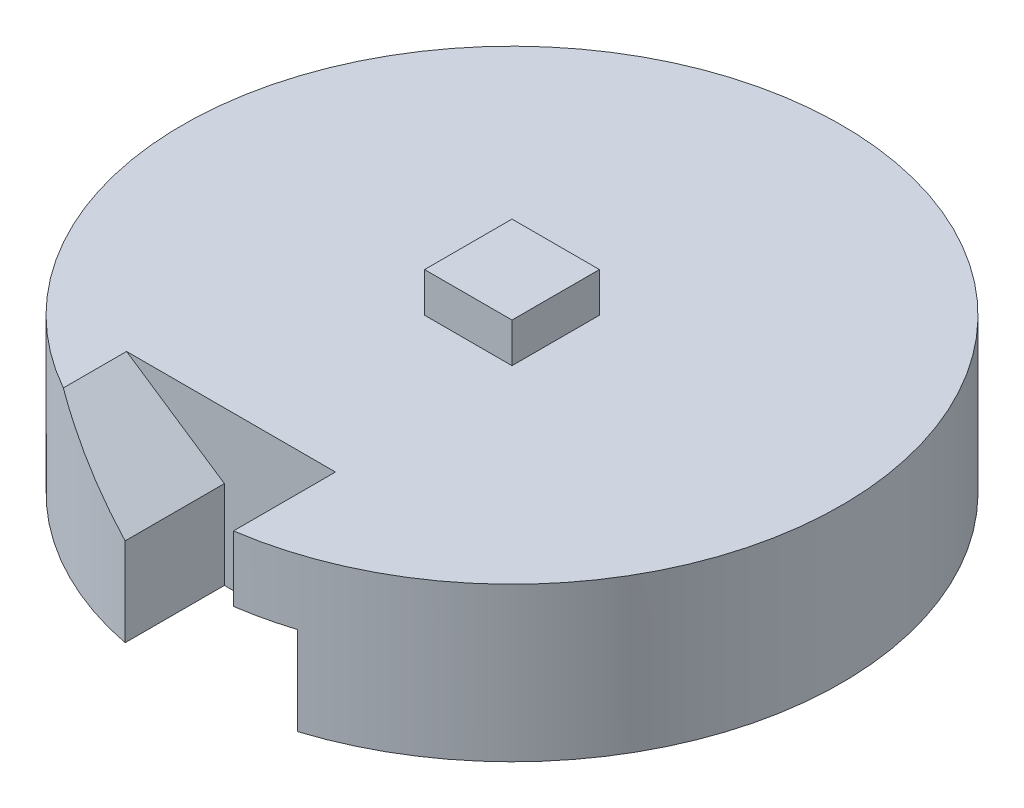
from build123d import *

# Parameters (mm, degrees)
SKETCH1_R           = 37.5
BOSS_EXTRUDE1_DEPTH = 17.5
CUT_EXTRUDE3_DEPTH  = 12
SKETCH9_W           = 9.95
SKETCH9_H           = 9.95
BOSS_EXTRUDE2_DEPTH = 22
SKETCH2_R           = 5
BOSS_EXTRUDE3_DEPTH = 10
CUT_EXTRUDE5_DEPTH  = 10
CUT_EXTRUDE6_DEPTH  = 2


with BuildPart() as part:
    # Sketch1 → Boss-Extrude1 (new body)
    with BuildSketch(Plane(origin=(0, 0, 0), x_dir=(1, 0, 0), z_dir=(0, 1, 0))):
        Circle(SKETCH1_R)
    extrude(amount=BOSS_EXTRUDE1_DEPTH)

    # Sketch7 → Cut-Extrude3 (cut)
    with BuildSketch(Plane.XY.offset(37.5)):
        Polygon((5.409167976, 17.669921883), (-18.615329351, 17.669921883), (-7.232029952, 10.040131917), (-7.232029952, -0.186148413), (11.337754855, -0.186148413), (11.337754855, 10.05869391), (5.409167976, 10.05869391), align=None)
    extrude(amount=-CUT_EXTRUDE3_DEPTH, mode=Mode.SUBTRACT)

    # Sketch9 → Boss-Extrude2 (add)
    with BuildSketch(Plane(origin=(0, 0, 0), x_dir=(1, 0, 0), z_dir=(0, 1, 0))):
        Rectangle(SKETCH9_W, SKETCH9_H)
    extrude(amount=BOSS_EXTRUDE2_DEPTH)

    # Sketch2 → Boss-Extrude3 (add)
    with BuildSketch(Plane.XZ):
        Circle(SKETCH2_R)
    extrude(amount=BOSS_EXTRUDE3_DEPTH)

    # Sketch11 → Cut-Extrude5 (cut)
    with BuildSketch(Plane.XZ.offset(10)):
        with BuildLine():
            Line((0.018011531, -1.443232403), (0.565734089, -1.443232403))
            ThreePointArc((0.565734089, -1.443232403), (0.018011531, 1.556767597), (-0.529711026, -1.443232403))
            Line((-0.529711026, -1.443232403), (0.018011531, -1.443232403))
        make_face()
    extrude(amount=-CUT_EXTRUDE5_DEPTH, mode=Mode.SUBTRACT)

    # Sketch12 → Cut-Extrude6 (cut)
    with BuildSketch(Plane(origin=(0, 0, 0), x_dir=(-1, 0, 0), z_dir=(0, -1, 0))):
        with BuildLine():
            Line((-31.522768768, -2.6309495), (-30.018011531, -5.228400909))
            Line((-30.018011531, -5.228400909), (-28.513254295, -2.6309495))
            ThreePointArc((-28.513254295, -2.6309495), (-30.018011531, 3.018232403), (-31.522768768, -2.6309495))
        make_face()
        with BuildLine():
            ThreePointArc((32.995326485, -0.272133378), (28.596593727, 2.682341253), (28.448805056, -2.614443502))
            Line((28.448805056, -2.614443502), (29.981988469, -5.228400909))
            Line((29.981988469, -5.228400909), (31.725749943, -2.47859302))
            ThreePointArc((31.725749943, -2.47859302), (32.53663496, -1.626769544), (32.961379359, -0.530079095))
            Line((32.961379359, -0.530079095), (33.124952896, -0.272133378))
            Line((33.124952896, -0.272133378), (32.995326485, -0.272133378))
        make_face()
    extrude(amount=-CUT_EXTRUDE6_DEPTH, mode=Mode.SUBTRACT)


solid = part.part
